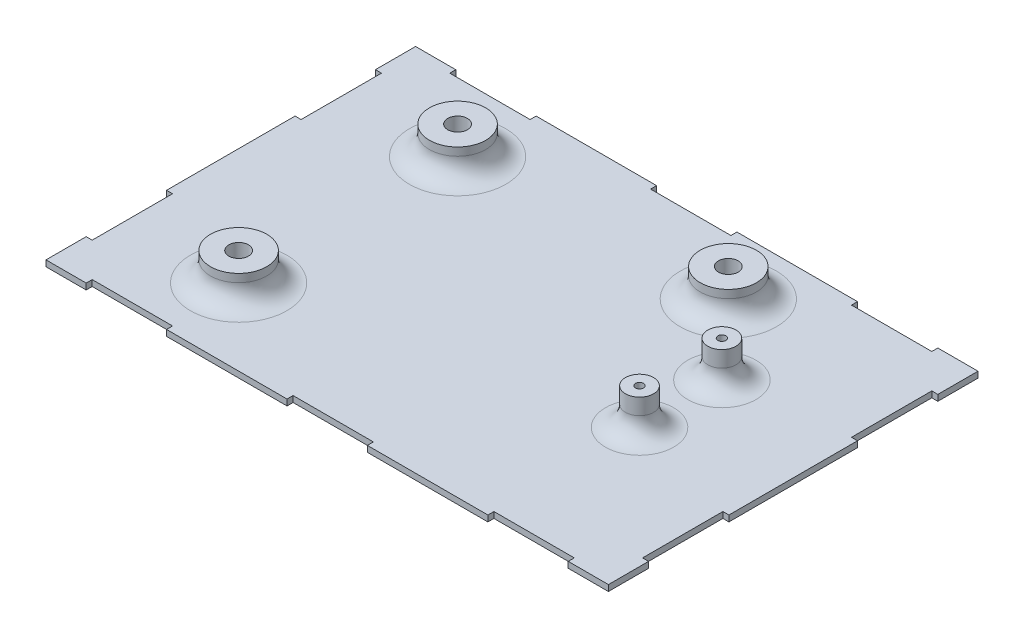
from build123d import *

# Parameters (mm, degrees)
SKETCH1_W           = 140
SKETCH1_H           = 92
BOSS_EXTRUDE1_DEPTH = 1.5
SKETCH2_W           = 1.5
SKETCH2_H           = 20
SKETCH2_W_2         = 20
SKETCH2_H_2         = 1.5
CUT_EXTRUDE1_DEPTH  = 84.77499627
SKETCH3_R           = 7
SKETCH3_R_2         = 3.5
BOSS_EXTRUDE2_DEPTH = 7
SKETCH6_R           = 3.5
BOSS_EXTRUDE3_DEPTH = 2
SKETCH7_R           = 2.45
CUT_EXTRUDE4_DEPTH  = 5.1
SKETCH8_R           = 1
CUT_EXTRUDE5_DEPTH  = 7
FILLET1_R           = 5


with BuildPart() as part:
    # Sketch1 → Boss-Extrude1 (new body)
    with BuildSketch(Plane(origin=(0, 0, 0), x_dir=(1, 0, 0), z_dir=(0, 1, 0))):
        Rectangle(SKETCH1_W, SKETCH1_H)
    extrude(amount=BOSS_EXTRUDE1_DEPTH)

    # Sketch2 → Cut-Extrude1 (cut, through all)
    with BuildSketch(Plane(origin=(0, 1.5, 0), x_dir=(1, 0, 0), z_dir=(0, 1, 0))):
        with Locations((69.25, 26)):
            Rectangle(SKETCH2_W, SKETCH2_H)
        with Locations((69.25, -26)):
            Rectangle(SKETCH2_W, SKETCH2_H)
        with Locations((50, -45.25)):
            Rectangle(SKETCH2_W_2, SKETCH2_H_2)
        with Locations((-50, -45.25)):
            Rectangle(SKETCH2_W_2, SKETCH2_H_2)
        with Locations((0, -45.25)):
            Rectangle(SKETCH2_W_2, SKETCH2_H_2)
        with Locations((-50, 45.25)):
            Rectangle(SKETCH2_W_2, SKETCH2_H_2)
        with Locations((0, 45.25)):
            Rectangle(SKETCH2_W_2, SKETCH2_H_2)
        with Locations((50, 45.25)):
            Rectangle(SKETCH2_W_2, SKETCH2_H_2)
        with Locations((-69.25, 26)):
            Rectangle(SKETCH2_W, SKETCH2_H)
        with Locations((-69.25, -26)):
            Rectangle(SKETCH2_W, SKETCH2_H)
    extrude(amount=-CUT_EXTRUDE1_DEPTH, mode=Mode.SUBTRACT)

    # Sketch3 → Boss-Extrude2 (add)
    with BuildSketch(Plane(origin=(0, 1.5, 0), x_dir=(1, 0, 0), z_dir=(0, 1, 0))):
        with Locations((-41.05, 27.5)):
            Circle(SKETCH3_R)
        with Locations((-41.05, -27)):
            Circle(SKETCH3_R)
        with Locations((23.35, 30.5)):
            Circle(SKETCH3_R)
        with Locations((40, 12.25)):
            Circle(SKETCH3_R_2)
        with Locations((40, -8.25)):
            Circle(SKETCH3_R_2)
    extrude(amount=BOSS_EXTRUDE2_DEPTH)

    # Sketch6 → Boss-Extrude3 (add)
    with BuildSketch(Plane(origin=(0, 8.5, 0), x_dir=(1, 0, 0), z_dir=(0, 1, 0))):
        with Locations((40, 12.25)):
            Circle(SKETCH6_R)
        with Locations((40, -8.25)):
            Circle(SKETCH6_R)
    extrude(amount=BOSS_EXTRUDE3_DEPTH)

    # Sketch7 → Cut-Extrude4 (cut)
    with BuildSketch(Plane(origin=(0, 8.5, 0), x_dir=(1, 0, 0), z_dir=(0, 1, 0))):
        with Locations((-41.05, 27.5)):
            Circle(SKETCH7_R)
        with Locations((23.35, 30.5)):
            Circle(SKETCH7_R)
        with Locations((-41.05, -27)):
            Circle(SKETCH7_R)
    extrude(amount=-CUT_EXTRUDE4_DEPTH, mode=Mode.SUBTRACT)

    # Sketch8 → Cut-Extrude5 (cut)
    with BuildSketch(Plane(origin=(0, 10.5, 0), x_dir=(1, 0, 0), z_dir=(0, 1, 0))):
        with Locations((40, 12.25)):
            Circle(SKETCH8_R)
        with Locations((40, -8.25)):
            Circle(SKETCH8_R)
    extrude(amount=-CUT_EXTRUDE5_DEPTH, mode=Mode.SUBTRACT)

    # Fillet1
    fillet1_edges = [part.edges().sort_by_distance(p)[0] for p in [
        (36.5, 1.5, 8.25),
        (36.5, 1.5, -12.25),
        (16.35, 1.5, -30.5),
        (-48.05, 1.5, 27),
        (-48.05, 1.5, -27.5),
    ]]
    fillet(fillet1_edges, radius=FILLET1_R)


solid = part.part
